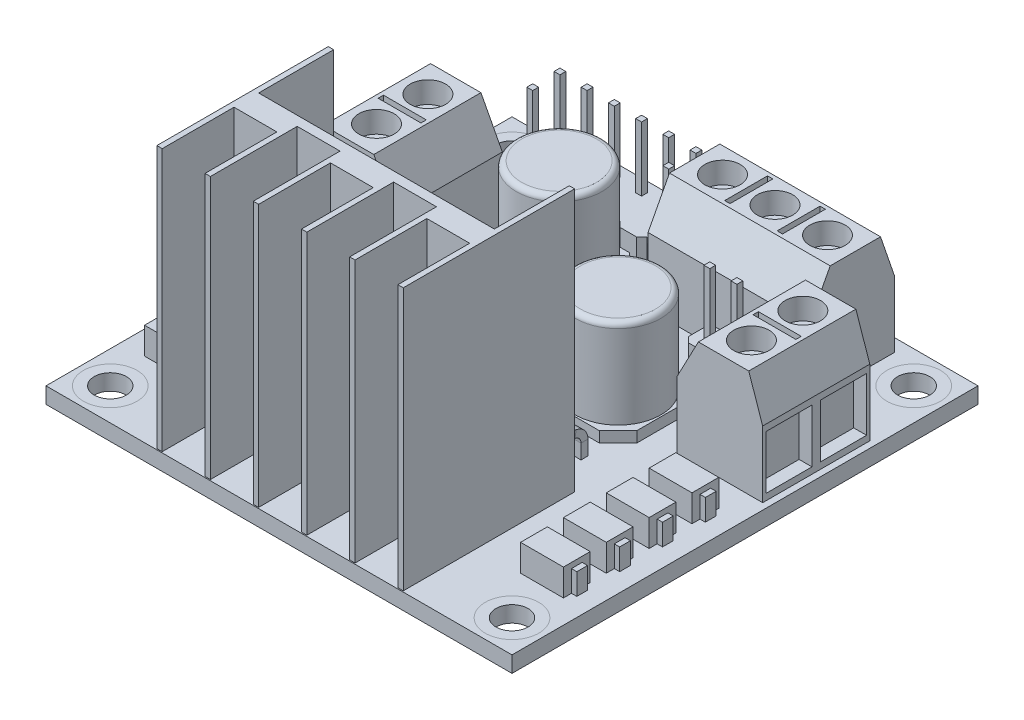
from build123d import *

# Parameters (mm, degrees)
SKETCH1_W              = 43.5
SKETCH1_H              = 43.5
SKETCH1_R              = 1.5
BOSS_EXTRUDE1_DEPTH    = 1.5
BOSS_EXTRUDE2_DEPTH    = 24.5
SKETCH4_R              = 1.5
CUT_EXTRUDE1_DEPTH     = 50.959508604
SKETCH5_W              = 4
SKETCH5_H              = 2.5
BOSS_EXTRUDE3_DEPTH    = 2.5
BOSS_EXTRUDE8_START    = -4.5
SKETCH10_W             = 1
SKETCH10_H             = 2
BOSS_EXTRUDE8_DEPTH    = 5
LPATTERN1_COUNT        = 4
LPATTERN1_PITCH        = 4
SKETCH6_W              = 15
SKETCH6_H              = 8
BOSS_EXTRUDE4_DEPTH    = 10
CHAMFER1_SIZE          = 3.8
CHAMFER1_SIZE2         = 1.3
CHAMFER2_SIZE          = 3.8
CHAMFER2_SIZE2         = 2
SKETCH7_R              = 1.65
CUT_EXTRUDE2_DEPTH     = 2
SKETCH11_W             = 4.3
SKETCH11_H             = 5
CUT_EXTRUDE3_DEPTH     = 1.2
SKETCH21_W             = 0.5
SKETCH21_H             = 4
CUT_EXTRUDE4_DEPTH     = 5
SKETCH22_W             = 8
SKETCH22_H             = 10
BOSS_EXTRUDE13_DEPTH   = 10
CHAMFER5_SIZE          = 3.8
CHAMFER5_SIZE2         = 1.3
CHAMFER6_SIZE          = 3.8
CHAMFER6_SIZE2         = 2
SKETCH23_R             = 1.65
CUT_EXTRUDE5_DEPTH     = 2
SKETCH24_W             = 4
SKETCH24_H             = 0.5
CUT_EXTRUDE6_DEPTH     = 5
SKETCH25_W             = 4.3
SKETCH25_H             = 5
CUT_EXTRUDE7_DEPTH     = 1.2
SKETCH8_R              = 1.75
BOSS_EXTRUDE5_DEPTH    = 1.6
CHAMFER3_SIZE          = 1
SKETCH9_W              = 20
SKETCH9_H              = 9.5
BOSS_EXTRUDE7_DEPTH    = 3.2
CHAMFER4_SIZE          = 3.2
CHAMFER4_SIZE_2        = 0.279963723
SKETCH16_W             = 0.65
SKETCH16_H             = 0.65
LPATTERN4_COUNT        = 8
LPATTERN4_PITCH        = 2.54
LPATTERN5_START        = -5.405
LPATTERN5_DEPTH        = 0.65
LPATTERN5_START_2      = -2.865
LPATTERN5_2_DEPTH      = 0.65
LPATTERN5_START_3      = -0.325
LPATTERN5_3_DEPTH      = 0.65
LPATTERN5_START_4      = 2.215
LPATTERN5_4_DEPTH      = 0.65
LPATTERN5_START_5      = 4.755
LPATTERN5_5_DEPTH      = 0.65
LPATTERN5_START_6      = 7.295
LPATTERN5_6_DEPTH      = 0.65
SKETCH18_W             = 0.65
SKETCH18_H             = 0.65
BOSS_EXTRUDE11_DEPTH   = 1
SKETCH20_R             = 4
BOSS_EXTRUDE12_DEPTH   = 8.3
FILLET1_R              = 0.5
BOSS_EXTRUDE9_DEPTH    = 2.5
LPATTERN2_COUNT        = 6
LPATTERN2_PITCH        = 2.54
SKETCH13_W             = 0.55
SKETCH13_H             = 0.55
BOSS_EXTRUDE10_DEPTH   = 6
LPATTERN3_COUNT        = 6
LPATTERN3_PITCH        = 2.54
LPATTERN3_COUNT_DIR2   = 2
LPATTERN3_PITCH_DIR2   = 2.54
SKETCH26_W             = 7.3
SKETCH26_H             = 6.5
BOSS_EXTRUDE14_DEPTH   = 0.8
CHAMFER7_SIZE          = 0.5
SKETCH27_W             = 6
SKETCH27_H             = 6.9
BOSS_EXTRUDE15_DEPTH   = 2.3
SKETCH28_W             = 0.9
SKETCH28_H             = 1.3
BOSS_EXTRUDE16_DEPTH   = 2.5
BOSS_EXTRUDE16_2_DEPTH = 2.5
BOSS_EXTRUDE17_DEPTH   = 2.5
SKETCH30_W             = 0.55
SKETCH30_H             = 0.55
BOSS_EXTRUDE18_DEPTH   = 6


with BuildPart() as part:
    # Sketch1 → Boss-Extrude1 (new body)
    with BuildSketch(Plane(origin=(0, 0, 0), x_dir=(1, 0, 0), z_dir=(0, 1, 0))):
        Rectangle(SKETCH1_W, SKETCH1_H)
        with Locations(Location((-18.75, 18.75, 0), (0, 0, 270))):
            Circle(SKETCH1_R, mode=Mode.SUBTRACT)
        with Locations(Location((18.75, 18.75, 0), (0, 0, 270))):
            Circle(SKETCH1_R, mode=Mode.SUBTRACT)
        with Locations(Location((18.75, -18.75, 0), (0, 0, 270))):
            Circle(SKETCH1_R, mode=Mode.SUBTRACT)
        with Locations(Location((-18.75, -18.75, 0), (0, 0, 270))):
            Circle(SKETCH1_R, mode=Mode.SUBTRACT)
    extrude(amount=BOSS_EXTRUDE1_DEPTH)



with BuildPart() as body_2:
    # Sketch3 → Boss-Extrude2 (new body)
    with BuildSketch(Plane(origin=(0, 1.5, 0), x_dir=(1, 0, 0), z_dir=(0, 1, 0))):
        Polygon((0, -12.65), (0, -14.95), (-2, -14.95), (-2, -21.65), (-2.5, -21.65), (-2.5, -13.55), (-6.5, -13.55), (-6.5, -21.65), (-7, -21.65), (-7, -14.95), (-11, -14.95), (-11, -21.65), (-11.5, -21.65), (-11.5, -5.65), (-11, -5.65), (-11, -12.65), align=None)
    boss_extrude2 = extrude(amount=BOSS_EXTRUDE2_DEPTH)

    # Mirror2: Boss-Extrude2 across plane
    add(boss_extrude2.mirror(Plane(origin=(0, 26, 12.65), x_dir=(0, 0, 1), z_dir=(-1, 0, 0))))

    # Sketch4 → Cut-Extrude1 (cut, through all)
    with BuildSketch(Plane.XY.offset(14.95)):
        with Locations((0, 20)):
            Circle(SKETCH4_R)
    extrude(amount=-CUT_EXTRUDE1_DEPTH, mode=Mode.SUBTRACT)


with BuildPart() as body_3:
    # Sketch5 → Boss-Extrude3 (new body)
    with BuildSketch(Plane(origin=(0, 1.5, 0), x_dir=(1, 0, 0), z_dir=(0, 1, 0))):
        with Locations((-17.55, -13.5)):
            Rectangle(SKETCH5_W, SKETCH5_H)
    extrude(amount=BOSS_EXTRUDE3_DEPTH)

    # Sketch10 → Boss-Extrude8 (add)
    with BuildSketch(Plane.ZY.offset(19.55).offset(BOSS_EXTRUDE8_START)):
        with Locations((13.5, 2.5)):
            Rectangle(SKETCH10_W, SKETCH10_H)
    extrude(amount=BOSS_EXTRUDE8_DEPTH)


with BuildPart() as lpattern1_1:
    # LPattern1: pattern copy
    add(body_3.part.moved(Location(Vector(0, 0, -1) * (1 * LPATTERN1_PITCH))))


with BuildPart() as lpattern1_2:
    # LPattern1: pattern copy
    add(body_3.part.moved(Location(Vector(0, 0, -1) * (2 * LPATTERN1_PITCH))))


with BuildPart() as lpattern1_3:
    # LPattern1: pattern copy
    add(body_3.part.moved(Location(Vector(0, 0, -1) * (3 * LPATTERN1_PITCH))))


with BuildPart() as body_7:
    # Mirror3: mirrored copy
    add(body_3.part.mirror(Plane(origin=(0, 0, 0), x_dir=(0, 0, 1), z_dir=(1, 0, 0))))


with BuildPart() as body_8:
    # Mirror3 2: mirrored copy
    add(lpattern1_1.part.mirror(Plane(origin=(0, 0, 0), x_dir=(0, 0, 1), z_dir=(1, 0, 0))))


with BuildPart() as body_9:
    # Mirror3 3: mirrored copy
    add(lpattern1_2.part.mirror(Plane(origin=(0, 0, 0), x_dir=(0, 0, 1), z_dir=(1, 0, 0))))


with BuildPart() as body_10:
    # Mirror3 4: mirrored copy
    add(lpattern1_3.part.mirror(Plane(origin=(0, 0, 0), x_dir=(0, 0, 1), z_dir=(1, 0, 0))))


with BuildPart() as body_11:
    # Sketch6 → Boss-Extrude4 (new body)
    with BuildSketch(Plane(origin=(0, 1.5, 0), x_dir=(1, 0, 0), z_dir=(0, 1, 0))):
        with Locations((7.65, 16.55)):
            Rectangle(SKETCH6_W, SKETCH6_H)
    extrude(amount=BOSS_EXTRUDE4_DEPTH)

    # Chamfer1
    chamfer1_edges = [body_11.edges().sort_by_distance(p)[0] for p in [
        (7.65, 11.5, -20.55),
    ]]
    chamfer1_side = [body_11.faces().sort_by_distance(p)[0] for p in [
        (7.65, 6.5, -20.55),
    ]]
    chamfer(chamfer1_edges, length=CHAMFER1_SIZE, length2=CHAMFER1_SIZE2, reference=chamfer1_side[0])

    # Chamfer2
    chamfer2_edges = [body_11.edges().sort_by_distance(p)[0] for p in [
        (7.65, 11.5, -12.55),
    ]]
    chamfer2_side = [body_11.faces().sort_by_distance(p)[0] for p in [
        (7.65, 6.5, -12.55),
    ]]
    chamfer(chamfer2_edges, length=CHAMFER2_SIZE, length2=CHAMFER2_SIZE2, reference=chamfer2_side[0])

    # Sketch7 → Cut-Extrude2 (cut)
    with BuildSketch(Plane(origin=(0, 11.5, 0), x_dir=(1, 0, 0), z_dir=(0, 1, 0))):
        with Locations(Location((12.55, 16.9, 0), (0, 0, 270))):
            Circle(SKETCH7_R)
        with Locations(Location((7.65, 16.9, 0), (0, 0, 270))):
            Circle(SKETCH7_R)
        with Locations(Location((2.75, 16.9, 0), (0, 0, 270))):
            Circle(SKETCH7_R)
    extrude(amount=-CUT_EXTRUDE2_DEPTH, mode=Mode.SUBTRACT)

    # Sketch11 → Cut-Extrude3 (cut)
    with BuildSketch(Plane(origin=(0, 0, -20.55), x_dir=(-1, 0, 0), z_dir=(0, 0, -1))):
        with Locations((-12.55, 4.6)):
            Rectangle(SKETCH11_W, SKETCH11_H)
        with Locations((-7.65, 4.6)):
            Rectangle(SKETCH11_W, SKETCH11_H)
        with Locations((-2.75, 4.6)):
            Rectangle(SKETCH11_W, SKETCH11_H)
    extrude(amount=-CUT_EXTRUDE3_DEPTH, mode=Mode.SUBTRACT)

    # Sketch21 → Cut-Extrude4 (cut)
    with BuildSketch(Plane(origin=(0, 11.5, 0), x_dir=(1, 0, 0), z_dir=(0, 1, 0))):
        with Locations((10.1, 16.9)):
            Rectangle(SKETCH21_W, SKETCH21_H)
        with Locations((5.2, 16.9)):
            Rectangle(SKETCH21_W, SKETCH21_H)
    extrude(amount=-CUT_EXTRUDE4_DEPTH, mode=Mode.SUBTRACT)


with BuildPart() as body_12:
    # Sketch22 → Boss-Extrude13 (new body)
    with BuildSketch(Plane(origin=(0, 1.5, 0), x_dir=(1, 0, 0), z_dir=(0, 1, 0))):
        with Locations((-17.15, 7.25)):
            Rectangle(SKETCH22_W, SKETCH22_H)
    extrude(amount=BOSS_EXTRUDE13_DEPTH)

    # Chamfer5
    chamfer5_edges = [body_12.edges().sort_by_distance(p)[0] for p in [
        (-21.15, 11.5, -7.25),
    ]]
    chamfer5_side = [body_12.faces().sort_by_distance(p)[0] for p in [
        (-21.15, 6.5, -7.25),
    ]]
    chamfer(chamfer5_edges, length=CHAMFER5_SIZE, length2=CHAMFER5_SIZE2, reference=chamfer5_side[0])

    # Chamfer6
    chamfer6_edges = [body_12.edges().sort_by_distance(p)[0] for p in [
        (-13.15, 11.5, -7.25),
    ]]
    chamfer6_side = [body_12.faces().sort_by_distance(p)[0] for p in [
        (-13.15, 6.5, -7.25),
    ]]
    chamfer(chamfer6_edges, length=CHAMFER6_SIZE, length2=CHAMFER6_SIZE2, reference=chamfer6_side[0])

    # Sketch23 → Cut-Extrude5 (cut)
    with BuildSketch(Plane(origin=(0, 11.5, 0), x_dir=(1, 0, 0), z_dir=(0, 1, 0))):
        with Locations(Location((-17.5, 9.65, 0), (0, 0, 270))):
            Circle(SKETCH23_R)
        with Locations(Location((-17.5, 4.85, 0), (0, 0, 270))):
            Circle(SKETCH23_R)
    extrude(amount=-CUT_EXTRUDE5_DEPTH, mode=Mode.SUBTRACT)

    # Sketch24 → Cut-Extrude6 (cut)
    with BuildSketch(Plane(origin=(0, 11.5, 0), x_dir=(1, 0, 0), z_dir=(0, 1, 0))):
        with Locations((-17.5, 7.25)):
            Rectangle(SKETCH24_W, SKETCH24_H)
    extrude(amount=-CUT_EXTRUDE6_DEPTH, mode=Mode.SUBTRACT)

    # Sketch25 → Cut-Extrude7 (cut)
    with BuildSketch(Plane.ZY.offset(21.15)):
        with Locations((-9.8, 4.6)):
            Rectangle(SKETCH25_W, SKETCH25_H)
        with Locations((-4.7, 4.6)):
            Rectangle(SKETCH25_W, SKETCH25_H)
    extrude(amount=-CUT_EXTRUDE7_DEPTH, mode=Mode.SUBTRACT)


with BuildPart() as body_13:
    # Mirror5: mirrored copy
    add(body_12.part.mirror(Plane(origin=(0, 0, 0), x_dir=(0, 0, 1), z_dir=(1, 0, 0))))


with BuildPart() as body_14:
    # Sketch8 → Boss-Extrude5 (new body)
    with BuildSketch(Plane(origin=(0, 0, 12.65), x_dir=(-1, 0, 0), z_dir=(0, 0, -1))):
        Polygon((-8, 23), (8, 23), (10, 21), (10, 7), (-10, 7), (-10, 21), align=None)
        with Locations((0, 20)):
            Circle(SKETCH8_R, mode=Mode.SUBTRACT)
    extrude(amount=BOSS_EXTRUDE5_DEPTH)

    # Chamfer3
    chamfer3_edges = [body_14.edges().sort_by_distance(p)[0] for p in [
        (1.75, 20, 11.05),
    ]]
    chamfer(chamfer3_edges, length=CHAMFER3_SIZE)


with BuildPart() as body_15:
    # Sketch9 → Boss-Extrude7 (new body)
    with BuildSketch(Plane(origin=(0, 0, 11.05), x_dir=(-1, 0, 0), z_dir=(0, 0, -1))):
        with Locations((0, 11.75)):
            Rectangle(SKETCH9_W, SKETCH9_H)
    extrude(amount=BOSS_EXTRUDE7_DEPTH)

    # Chamfer4
    # the kernel refuses this chamfer: 3.2, 0.279963723 mm, written as the material it takes off along each edge
    with BuildSketch(Plane(origin=(-18.318829055, 16.5, 7.85), x_dir=(0, 0, 1), z_dir=(1, 0, 0)), Plane(origin=(18.318829055, 7, 7.85), x_dir=(0, 0, 1), z_dir=(-1, 0, 0))) as chamfer4_piece_1:
        Polygon((CHAMFER4_SIZE, 0), (0, CHAMFER4_SIZE_2 * 1.00000000101), (0, 0), align=None)
    extrude(amount=36.637658111, mode=Mode.SUBTRACT)
    with BuildSketch(Plane(origin=(-10, -1.318829055, 7.85), x_dir=(0, 0, 1), z_dir=(0, 1, 0)), Plane(origin=(10, 24.818829055, 7.85), x_dir=(0, 0, 1), z_dir=(0, -1, 0))) as chamfer4_piece_2:
        Polygon((CHAMFER4_SIZE, 0), (0, CHAMFER4_SIZE_2 * 1.00000000101), (0, 0), align=None)
    extrude(amount=26.137658111, mode=Mode.SUBTRACT)


with BuildPart() as part_1:
    add(part.part)

    add(body_15.part)  # Sweep1 merges body 15
    # Sweep1: sweep along a path in Sketch15
    with BuildLine(Plane.ZY.offset(8.89)) as sweep1_path:
        Line((9.45, 7.139981862), (9.45, 5.776234994))
        ThreePointArc((9.45, 5.776234994), (9.216044443, 5.133447385), (8.623648178, 4.791427241))
        Line((8.623648178, 4.791427241), (3.276351822, 3.84855462))
        ThreePointArc((3.276351822, 3.84855462), (2.683955557, 3.506534477), (2.45, 2.863746867))
        Line((2.45, 2.863746867), (2.45, 1.5))
    # Sketch16 → Sweep1 (sweep)
    with BuildSketch(Plane(origin=(0, 1.5, 0), x_dir=(1, 0, 0), z_dir=(0, 1, 0))):
        with Locations((-8.89, -2.45)):
            Rectangle(SKETCH16_W, SKETCH16_H)
    sweep1 = sweep(path=sweep1_path.line)

    # LPattern4: Sweep1 ×8
    with Locations(*[(i * LPATTERN4_PITCH, 0, 0) for i in range(1, LPATTERN4_COUNT)]):
        add(sweep1)

    # LPattern5: read off the stored shape, not the designer's step
    # LPattern5 outline → LPattern5 (add)
    with BuildSketch(Plane.YZ.offset(LPATTERN5_START)):
        with BuildLine():
            Line((7.139981862, 9.125), (7.139981862, 9.45))
            Line((7.139981862, 9.45), (7.111548046, 9.775))
            Line((7.111548046, 9.775), (5.776234994, 9.775))
            ThreePointArc((5.776234994, 9.775), (4.924541412, 9.465008887), (4.471364722, 8.680083835))
            Line((4.471364722, 8.680083835), (4.424233162, 8.41278748))
            ThreePointArc((4.424233162, 8.41278748), (4.193369566, 8.012920001), (3.759487929, 7.855))
            Line((3.759487929, 7.855), (1.5, 7.855))
            Line((1.5, 7.855), (1.5, 7.205))
            Line((1.5, 7.205), (3.759487929, 7.205))
            ThreePointArc((3.759487929, 7.205), (4.611181512, 7.514991113), (5.064358202, 8.299916165))
            Line((5.064358202, 8.299916165), (5.111489761, 8.56721252))
            ThreePointArc((5.111489761, 8.56721252), (5.342353358, 8.967079999), (5.776234994, 9.125))
            Line((5.776234994, 9.125), (7.139981862, 9.125))
        make_face()
    extrude(amount=LPATTERN5_DEPTH)

    # LPattern5 2 outline → LPattern5 2 (add)
    with BuildSketch(Plane.YZ.offset(LPATTERN5_START_2)):
        with BuildLine():
            Line((7.139981862, 9.125), (7.139981862, 9.45))
            Line((7.139981862, 9.45), (7.111548046, 9.775))
            Line((7.111548046, 9.775), (5.776234994, 9.775))
            ThreePointArc((5.776234994, 9.775), (4.924541412, 9.465008887), (4.471364722, 8.680083835))
            Line((4.471364722, 8.680083835), (4.424233162, 8.41278748))
            ThreePointArc((4.424233162, 8.41278748), (4.193369566, 8.012920001), (3.759487929, 7.855))
            Line((3.759487929, 7.855), (1.5, 7.855))
            Line((1.5, 7.855), (1.5, 7.205))
            Line((1.5, 7.205), (3.759487929, 7.205))
            ThreePointArc((3.759487929, 7.205), (4.611181512, 7.514991113), (5.064358202, 8.299916165))
            Line((5.064358202, 8.299916165), (5.111489761, 8.56721252))
            ThreePointArc((5.111489761, 8.56721252), (5.342353358, 8.967079999), (5.776234994, 9.125))
            Line((5.776234994, 9.125), (7.139981862, 9.125))
        make_face()
    extrude(amount=LPATTERN5_2_DEPTH)

    # LPattern5 3 outline → LPattern5 3 (add)
    with BuildSketch(Plane.YZ.offset(LPATTERN5_START_3)):
        with BuildLine():
            Line((7.139981862, 9.125), (7.139981862, 9.45))
            Line((7.139981862, 9.45), (7.111548046, 9.775))
            Line((7.111548046, 9.775), (5.776234994, 9.775))
            ThreePointArc((5.776234994, 9.775), (4.924541412, 9.465008887), (4.471364722, 8.680083835))
            Line((4.471364722, 8.680083835), (4.424233162, 8.41278748))
            ThreePointArc((4.424233162, 8.41278748), (4.193369566, 8.012920001), (3.759487929, 7.855))
            Line((3.759487929, 7.855), (1.5, 7.855))
            Line((1.5, 7.855), (1.5, 7.205))
            Line((1.5, 7.205), (3.759487929, 7.205))
            ThreePointArc((3.759487929, 7.205), (4.611181512, 7.514991113), (5.064358202, 8.299916165))
            Line((5.064358202, 8.299916165), (5.111489761, 8.56721252))
            ThreePointArc((5.111489761, 8.56721252), (5.342353358, 8.967079999), (5.776234994, 9.125))
            Line((5.776234994, 9.125), (7.139981862, 9.125))
        make_face()
    extrude(amount=LPATTERN5_3_DEPTH)

    # LPattern5 4 outline → LPattern5 4 (add)
    with BuildSketch(Plane.YZ.offset(LPATTERN5_START_4)):
        with BuildLine():
            Line((7.139981862, 9.125), (7.139981862, 9.45))
            Line((7.139981862, 9.45), (7.111548046, 9.775))
            Line((7.111548046, 9.775), (5.776234994, 9.775))
            ThreePointArc((5.776234994, 9.775), (4.924541412, 9.465008887), (4.471364722, 8.680083835))
            Line((4.471364722, 8.680083835), (4.424233162, 8.41278748))
            ThreePointArc((4.424233162, 8.41278748), (4.193369566, 8.012920001), (3.759487929, 7.855))
            Line((3.759487929, 7.855), (1.5, 7.855))
            Line((1.5, 7.855), (1.5, 7.205))
            Line((1.5, 7.205), (3.759487929, 7.205))
            ThreePointArc((3.759487929, 7.205), (4.611181512, 7.514991113), (5.064358202, 8.299916165))
            Line((5.064358202, 8.299916165), (5.111489761, 8.56721252))
            ThreePointArc((5.111489761, 8.56721252), (5.342353358, 8.967079999), (5.776234994, 9.125))
            Line((5.776234994, 9.125), (7.139981862, 9.125))
        make_face()
    extrude(amount=LPATTERN5_4_DEPTH)

    # LPattern5 5 outline → LPattern5 5 (add)
    with BuildSketch(Plane.YZ.offset(LPATTERN5_START_5)):
        with BuildLine():
            Line((7.139981862, 9.125), (7.139981862, 9.45))
            Line((7.139981862, 9.45), (7.111548046, 9.775))
            Line((7.111548046, 9.775), (5.776234994, 9.775))
            ThreePointArc((5.776234994, 9.775), (4.924541412, 9.465008887), (4.471364722, 8.680083835))
            Line((4.471364722, 8.680083835), (4.424233162, 8.41278748))
            ThreePointArc((4.424233162, 8.41278748), (4.193369566, 8.012920001), (3.759487929, 7.855))
            Line((3.759487929, 7.855), (1.5, 7.855))
            Line((1.5, 7.855), (1.5, 7.205))
            Line((1.5, 7.205), (3.759487929, 7.205))
            ThreePointArc((3.759487929, 7.205), (4.611181512, 7.514991113), (5.064358202, 8.299916165))
            Line((5.064358202, 8.299916165), (5.111489761, 8.56721252))
            ThreePointArc((5.111489761, 8.56721252), (5.342353358, 8.967079999), (5.776234994, 9.125))
            Line((5.776234994, 9.125), (7.139981862, 9.125))
        make_face()
    extrude(amount=LPATTERN5_5_DEPTH)

    # LPattern5 6 outline → LPattern5 6 (add)
    with BuildSketch(Plane.YZ.offset(LPATTERN5_START_6)):
        with BuildLine():
            Line((7.139981862, 9.125), (7.139981862, 9.45))
            Line((7.139981862, 9.45), (7.111548046, 9.775))
            Line((7.111548046, 9.775), (5.776234994, 9.775))
            ThreePointArc((5.776234994, 9.775), (4.924541412, 9.465008887), (4.471364722, 8.680083835))
            Line((4.471364722, 8.680083835), (4.424233162, 8.41278748))
            ThreePointArc((4.424233162, 8.41278748), (4.193369566, 8.012920001), (3.759487929, 7.855))
            Line((3.759487929, 7.855), (1.5, 7.855))
            Line((1.5, 7.855), (1.5, 7.205))
            Line((1.5, 7.205), (3.759487929, 7.205))
            ThreePointArc((3.759487929, 7.205), (4.611181512, 7.514991113), (5.064358202, 8.299916165))
            Line((5.064358202, 8.299916165), (5.111489761, 8.56721252))
            ThreePointArc((5.111489761, 8.56721252), (5.342353358, 8.967079999), (5.776234994, 9.125))
            Line((5.776234994, 9.125), (7.139981862, 9.125))
        make_face()
    extrude(amount=LPATTERN5_6_DEPTH)

    # Sweep2: sweep along a path in Sketch17
    with BuildLine(Plane.ZY.offset(7.62)) as sweep2_path:
        Line((9.45, 7.139981862), (9.45, 5.776234994))
        ThreePointArc((9.45, 5.776234994), (9.216044443, 5.133447385), (8.623648178, 4.791427241))
        Line((8.623648178, 4.791427241), (8.356351822, 4.744295682))
        ThreePointArc((8.356351822, 4.744295682), (7.763955557, 4.402275539), (7.53, 3.759487929))
        Line((7.53, 3.759487929), (7.53, 1.5))
    # Sketch18 → Sweep2 (sweep)
    with BuildSketch(Plane(origin=(0, 1.5, 0), x_dir=(1, 0, 0), z_dir=(0, 1, 0))):
        with Locations((-7.62, -7.53)):
            Rectangle(SKETCH18_W, SKETCH18_H)
    sweep(path=sweep2_path.line)


with BuildPart() as body_15_2:
    # Sketch19 → Boss-Extrude11 (new body)
    with BuildSketch(Plane(origin=(0, 1.5, 0), x_dir=(1, 0, 0), z_dir=(0, 1, 0))):
        Polygon((10.45, 1.2), (8.7, -0.55), (2.15, -0.55), (2.15, 7.75), (8.7, 7.75), (10.45, 6), align=None)
    extrude(amount=BOSS_EXTRUDE11_DEPTH)

    # Sketch20 → Boss-Extrude12 (add)
    with BuildSketch(Plane(origin=(0, 2.5, 0), x_dir=(1, 0, 0), z_dir=(0, 1, 0))):
        with Locations(Location((6.3, 3.6, 0), (0, 0, 90))):
            Circle(SKETCH20_R)
    extrude(amount=BOSS_EXTRUDE12_DEPTH)

    # Fillet1
    fillet1_edges = [body_15_2.edges().sort_by_distance(p)[0] for p in [
        (6.3, 10.8, 0.4),
    ]]
    fillet(fillet1_edges, radius=FILLET1_R)


with BuildPart() as body_16:
    # LPattern6: read off the stored shape, not the designer's step
    # LPattern6: copy of body 15 2
    add(body_15_2.part.moved(Location((-13, 0, -7.5))))


with BuildPart() as body_17:
    # Sketch12 → Boss-Extrude9 (new body)
    with BuildSketch(Plane(origin=(0, 1.5, 0), x_dir=(1, 0, 0), z_dir=(0, 1, 0))):
        Polygon((-15.45, 20.35), (-13.91, 20.35), (-13.41, 19.85), (-13.41, 15.85), (-13.91, 15.35), (-15.45, 15.35), (-15.95, 15.85), (-15.95, 19.85), align=None)
    boss_extrude9 = extrude(amount=BOSS_EXTRUDE9_DEPTH)

    # Sketch13 → Boss-Extrude10 (add)
    with BuildSketch(Plane(origin=(0, 4, 0), x_dir=(1, 0, 0), z_dir=(0, 1, 0))):
        with Locations((-14.68, 19.15)):
            Rectangle(SKETCH13_W, SKETCH13_H)
    boss_extrude10 = extrude(amount=BOSS_EXTRUDE10_DEPTH)



with BuildPart() as lpattern2_1:
    # LPattern2: pattern copy
    add(boss_extrude9.moved(Location(Vector(1, 0, 0) * (1 * LPATTERN2_PITCH))))


with BuildPart() as lpattern2_2:
    # LPattern2: pattern copy
    add(boss_extrude9.moved(Location(Vector(1, 0, 0) * (2 * LPATTERN2_PITCH))))


with BuildPart() as lpattern2_3:
    # LPattern2: pattern copy
    add(boss_extrude9.moved(Location(Vector(1, 0, 0) * (3 * LPATTERN2_PITCH))))


with BuildPart() as lpattern2_4:
    # LPattern2: pattern copy
    add(boss_extrude9.moved(Location(Vector(1, 0, 0) * (4 * LPATTERN2_PITCH))))


with BuildPart() as lpattern2_5:
    # LPattern2: pattern copy
    add(boss_extrude9.moved(Location(Vector(1, 0, 0) * (5 * LPATTERN2_PITCH))))


with BuildPart() as body_17_1:
    add(body_17.part)

    add(lpattern2_1.part)  # LPattern3 merges LPattern2_1

    add(lpattern2_2.part)  # LPattern3 merges LPattern2_2

    add(lpattern2_3.part)  # LPattern3 merges LPattern2_3

    add(lpattern2_4.part)  # LPattern3 merges LPattern2_4

    add(lpattern2_5.part)  # LPattern3 merges LPattern2_5
    # LPattern3: Boss-Extrude10 6 × 2, 4 skipped
    with Locations(*[(i * LPATTERN3_PITCH, 0, j * LPATTERN3_PITCH_DIR2) for i in range(LPATTERN3_COUNT) for j in range(LPATTERN3_COUNT_DIR2) if (i, j) not in ((0, 0), (1, 1), (2, 1), (3, 1), (4, 1))]):
        add(boss_extrude10)


with BuildPart() as body_18:
    # Sketch26 → Boss-Extrude14 (new body)
    with BuildSketch(Plane(origin=(0, 1.5, 0), x_dir=(1, 0, 0), z_dir=(0, 1, 0))):
        with Locations((-7.1, 2.5)):
            Rectangle(SKETCH26_W, SKETCH26_H)
    extrude(amount=BOSS_EXTRUDE14_DEPTH)

    # Chamfer7
    chamfer7_edges = [body_18.edges().sort_by_distance(p)[0] for p in [
        (-10.75, 1.9, 0.75),
        (-10.75, 1.9, -5.75),
    ]]
    chamfer(chamfer7_edges, length=CHAMFER7_SIZE)

    # Sketch27 → Boss-Extrude15 (add)
    with BuildSketch(Plane(origin=(0, 1.5, 0), x_dir=(1, 0, 0), z_dir=(0, 1, 0))):
        with Locations((-6.25, 2.5)):
            Rectangle(SKETCH27_W, SKETCH27_H)
    extrude(amount=BOSS_EXTRUDE15_DEPTH)


with BuildPart() as body_19:
    # Sketch28 → Boss-Extrude16 (new body)
    with BuildSketch(Plane(origin=(-3.25, 0, 0), x_dir=(0, 0, -1), z_dir=(1, 0, 0))):
        with Locations((-0.2, 2.15)):
            Rectangle(SKETCH28_W, SKETCH28_H)
    extrude(amount=BOSS_EXTRUDE16_DEPTH)


with BuildPart() as body_20:
    # Sketch28 → Boss-Extrude16 2 (new body)
    with BuildSketch(Plane(origin=(-3.25, 0, 0), x_dir=(0, 0, -1), z_dir=(1, 0, 0))):
        with Locations((5.2, 2.15)):
            Rectangle(SKETCH28_W, SKETCH28_H)
    extrude(amount=BOSS_EXTRUDE16_2_DEPTH)


with BuildPart() as body_21:
    # Sketch29 → Boss-Extrude17 (new body)
    with BuildSketch(Plane(origin=(0, 1.5, 0), x_dir=(1, 0, 0), z_dir=(0, 1, 0))):
        Polygon((11.75, 9.71), (11.25, 9.21), (7.25, 9.21), (6.75, 9.71), (6.75, 11.25), (7.25, 11.75), (11.25, 11.75), (11.75, 11.25), align=None)
    extrude(amount=BOSS_EXTRUDE17_DEPTH)

    # Sketch30 → Boss-Extrude18 (add)
    with BuildSketch(Plane(origin=(0, 4, 0), x_dir=(1, 0, 0), z_dir=(0, 1, 0))):
        with Locations((10.52, 10.48)):
            Rectangle(SKETCH30_W, SKETCH30_H)
        with Locations((7.98, 10.48)):
            Rectangle(SKETCH30_W, SKETCH30_H)
    extrude(amount=BOSS_EXTRUDE18_DEPTH)


solid = Compound([body_2.part, body_3.part, lpattern1_1.part, lpattern1_2.part, lpattern1_3.part, body_7.part, body_8.part, body_9.part, body_10.part, body_11.part, body_12.part, body_13.part, body_14.part, part_1.part, body_15_2.part, body_16.part, body_17_1.part, body_18.part, body_19.part, body_20.part, body_21.part])
